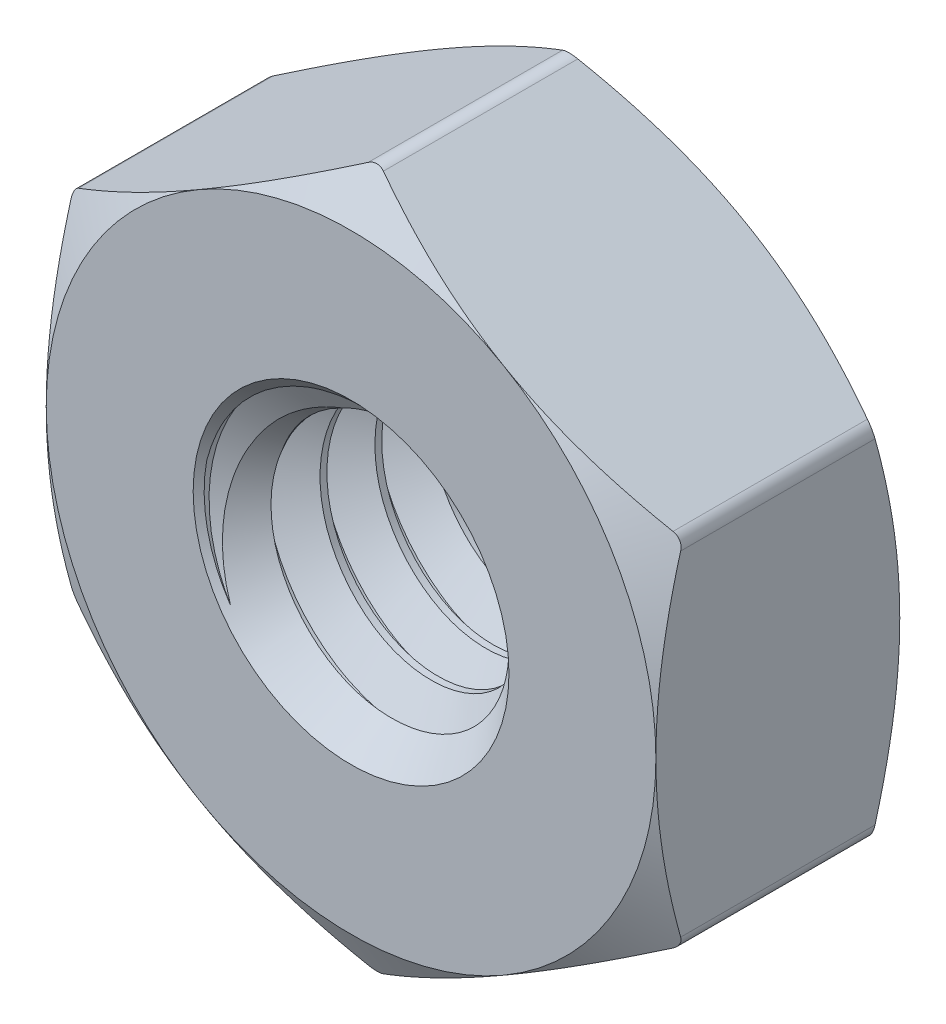
from build123d import *

# Parameters (mm, degrees)
BOSS_EXTRUDE2_DEPTH     = 1
CUT_EXTRUDE4_DEPTH      = 4.947573094
CUT_EXTRUDE4_DEPTH_BACK = 4.947573094
SKETCH16_R              = 1.25
SKETCH7_OUTSIDE_W       = 26.976
SKETCH7_OUTSIDE_H       = 27.75
SKETCH7_OUTSIDE_R       = 2.5
CUT_EXTRUDE5_DEPTH      = 5.310839052
CUT_EXTRUDE5_DRAFT      = -60
MIRROR4_COPY_1_SKETCH_W = 26.976
MIRROR4_COPY_1_SKETCH_H = 27.75
MIRROR4_COPY_1_SKETCH_R = 2.5
MIRROR4_COPY_1_DEPTH    = 5.310839052
MIRROR4_COPY_1_DRAFT    = -60
FILLET2_R               = 0.125
SKETCH13_R              = 1.25
BOSS_EXTRUDE1_DEPTH     = 2
CUT_SWEEP1_PITCH        = 0.45
SKETCH17_R              = 1.25
BOSS_EXTRUDE3_DEPTH     = 2


with BuildPart() as part:
    # Sketch15 → Boss-Extrude2 (new, symmetric)
    with BuildSketch(Plane.XY):
        Polygon((0, 2.886751346), (-2.5, 1.443375673), (-2.5, -1.443375673), (0, -2.886751346), (2.5, -1.443375673), (2.5, 1.443375673), align=None)
    extrude(amount=BOSS_EXTRUDE2_DEPTH, both=True)

    # Sketch16 → Cut-Extrude4 (cut, two sides: drawn at the far end of the back side and taken through both)
    with BuildSketch(Plane.XY.offset(-CUT_EXTRUDE4_DEPTH_BACK)):
        Circle(SKETCH16_R)
    extrude(amount=CUT_EXTRUDE4_DEPTH + CUT_EXTRUDE4_DEPTH_BACK, mode=Mode.SUBTRACT)


with BuildPart() as cut_extrude5_tool:
    # Sketch7 outside → Cut-Extrude5 (with draft: the straight prism first)
    with BuildSketch(Plane.XY.offset(1)):
        Rectangle(SKETCH7_OUTSIDE_W, SKETCH7_OUTSIDE_H)
        Circle(SKETCH7_OUTSIDE_R, mode=Mode.SUBTRACT)
    extrude(amount=-CUT_EXTRUDE5_DEPTH)
    # Cut-Extrude5: the draft: its side faces are tilted about the plane it starts from
    cut_extrude5_sides = [cut_extrude5_tool.faces().sort_by_distance(p)[0] for p in [
        (0, -13.875, -1.655419526),
        (13.488, 0, -1.655419526),
        (0, 13.875, -1.655419526),
        (-13.488, 0, -1.655419526),
        (-2.5, 0, -1.655419526),
    ]]
    draft(cut_extrude5_sides, Plane.XY.offset(1), CUT_EXTRUDE5_DRAFT)


with BuildPart() as part_1:
    add(part.part)

    # Cut-Extrude5: cut by cut_extrude5_tool
    add(cut_extrude5_tool.part, mode=Mode.SUBTRACT)


with BuildPart() as mirror4_copy_1_tool:
    # Mirror4 copy 1 sketch → Mirror4 copy 1 (with draft: the straight prism first)
    with BuildSketch(Plane(origin=(0, 0, -1), x_dir=(1, 0, 0), z_dir=(0, 0, -1))):
        Rectangle(MIRROR4_COPY_1_SKETCH_W, MIRROR4_COPY_1_SKETCH_H)
        Circle(MIRROR4_COPY_1_SKETCH_R, mode=Mode.SUBTRACT)
    extrude(amount=-MIRROR4_COPY_1_DEPTH)
    # Mirror4 copy 1: the draft: its side faces are tilted about the plane it starts from
    mirror4_copy_1_sides = [mirror4_copy_1_tool.faces().sort_by_distance(p)[0] for p in [
        (0, -13.875, 1.655419526),
        (13.488, 0, 1.655419526),
        (0, 13.875, 1.655419526),
        (-13.488, 0, 1.655419526),
        (-2.5, 0, 1.655419526),
    ]]
    draft(mirror4_copy_1_sides, Plane(origin=(0, 0, -1), x_dir=(1, 0, 0), z_dir=(0, 0, -1)), MIRROR4_COPY_1_DRAFT)


with BuildPart() as part_2:
    add(part_1.part)

    # Mirror4 copy 1: cut by mirror4_copy_1_tool
    add(mirror4_copy_1_tool.part, mode=Mode.SUBTRACT)

    # Fillet2
    fillet2_edges = [part_2.edges().sort_by_distance(p)[0] for p in [
        (-2.5, 1.443375673, 0),
        (-2.5, -1.443375673, 0),
        (0, -2.886751346, 0),
        (2.5, -1.443375673, 0),
        (2.5, 1.443375673, 0),
        (0, 2.886751346, 0),
    ]]
    fillet(fillet2_edges, radius=FILLET2_R)

    # Sketch17 → Boss-Extrude3 (add)
    with BuildSketch(Plane.XY.offset(1)):
        Circle(SKETCH17_R)
    extrude(amount=-BOSS_EXTRUDE3_DEPTH)


with BuildPart() as body_2:
    # Sketch13 → Boss-Extrude1 (new body)
    with BuildSketch(Plane(origin=(0, 0, -1), x_dir=(-1, 0, 0), z_dir=(0, 0, -1))):
        Circle(SKETCH13_R)
    extrude(amount=-BOSS_EXTRUDE1_DEPTH)

    # Cut-Sweep1: the profile of Sketch12 profile screwed along a right-hand helix of 6.444444 turns, 6 arcs to a turn; built about Z, then put on its axis
    cut_sweep1_z = Axis((0, 0, 0), (0, 0, 1))
    cut_sweep1_corners = [(1.2503, 0, -0.393923205), (1.2503, 0, 0.000173205), (0.957716426, 0, -0.16875), (0.957716426, 0, -0.225)]
    with BuildLine(mode=Mode.PRIVATE) as cut_sweep1_profile:
        Line(cut_sweep1_corners[0], cut_sweep1_corners[1])
        Line(cut_sweep1_corners[1], cut_sweep1_corners[2])
        Line(cut_sweep1_corners[2], cut_sweep1_corners[3])
        Line(cut_sweep1_corners[3], cut_sweep1_corners[0])
    cut_sweep1_cap = Face(cut_sweep1_profile.wire())
    cut_sweep1_turn_angles = [0, 30, 60, 90, 120, 150, 180, 210, 240, 270, 300, 330, 360]
    cut_sweep1_turn_weights = [1, 0.8660254037844387, 1, 0.8660254037844387, 1, 0.8660254037844387, 1, 0.8660254037844387, 1, 0.8660254037844387, 1, 0.8660254037844387, 1]
    cut_sweep1_turn_rails = [Edge.make_bspline([Vector(p[0], p[1], 0).rotate(cut_sweep1_z, cut_sweep1_turn_angles[k]) / cut_sweep1_turn_weights[k] + Vector(0, 0, p[2] + CUT_SWEEP1_PITCH * cut_sweep1_turn_angles[k] / 360) for k in range(13)], [0, 0, 0, 1, 1, 2, 2, 3, 3, 4, 4, 5, 5, 6, 6, 6], 2, cut_sweep1_turn_weights) for p in cut_sweep1_corners]
    cut_sweep1_turn_sides = [Face.make_surface_from_curves(cut_sweep1_turn_rails[p[0]], cut_sweep1_turn_rails[p[1]]) for p in [(0, 1), (1, 2), (2, 3), (3, 0)]]
    cut_sweep1_last_angles = [2160, 2190, 2220, 2250, 2280, 2300, 2320]
    cut_sweep1_last_weights = [1, 0.8660254037844387, 1, 0.8660254037844387, 1, 0.9396926207858622, 1]
    cut_sweep1_last_rails = [Edge.make_bspline([Vector(p[0], p[1], 0).rotate(cut_sweep1_z, cut_sweep1_last_angles[k]) / cut_sweep1_last_weights[k] + Vector(0, 0, p[2] + CUT_SWEEP1_PITCH * cut_sweep1_last_angles[k] / 360) for k in range(7)], [0, 0, 0, 1, 1, 2, 2, 3, 3, 3], 2, cut_sweep1_last_weights) for p in cut_sweep1_corners]
    cut_sweep1_last_sides = [Face.make_surface_from_curves(cut_sweep1_last_rails[p[0]], cut_sweep1_last_rails[p[1]]) for p in [(0, 1), (1, 2), (2, 3), (3, 0)]]
    cut_sweep1 = Plane(origin=(0, 0, -1), x_dir=(0, 1, 0), z_dir=(0, 0, 1)) * Solid(Shell([*[p.moved(Location((0, 0, CUT_SWEEP1_PITCH * i))) for i in range(6) for p in cut_sweep1_turn_sides], *cut_sweep1_last_sides, cut_sweep1_cap, cut_sweep1_cap.rotate(cut_sweep1_z, 2320).moved(Location((0, 0, CUT_SWEEP1_PITCH * 2320 / 360)))]))
    add(cut_sweep1, mode=Mode.SUBTRACT)


with BuildPart() as part_3:
    add(part_2.part)

    # Combine1: cut body 2
    add(body_2.part, mode=Mode.SUBTRACT)

    # Cut-Extrude2 cone 1 section (through the dimple's axis) → Cut-Extrude2 (revolve, cut)
    with BuildSketch(Plane(origin=(0, 0, 1), x_dir=(0, -1, 0), z_dir=(1, 0, 0))):
        Polygon((0, 0), (1.295, 0), (0, 1.295), align=None)
    revolve(axis=Axis((0, 0, 1), (0, 0, -1)), mode=Mode.SUBTRACT)

    # Cut-Extrude3 cone 1 section (through the dimple's axis) → Cut-Extrude3 (revolve, cut)
    with BuildSketch(Plane(origin=(0, 0, -1), x_dir=(0, 1, 0), z_dir=(1, 0, 0))):
        Polygon((0, 0), (1.295, 0), (0, 1.295), align=None)
    revolve(axis=Axis((0, 0, -1), (0, 0, 1)), mode=Mode.SUBTRACT)


solid = part_3.part
